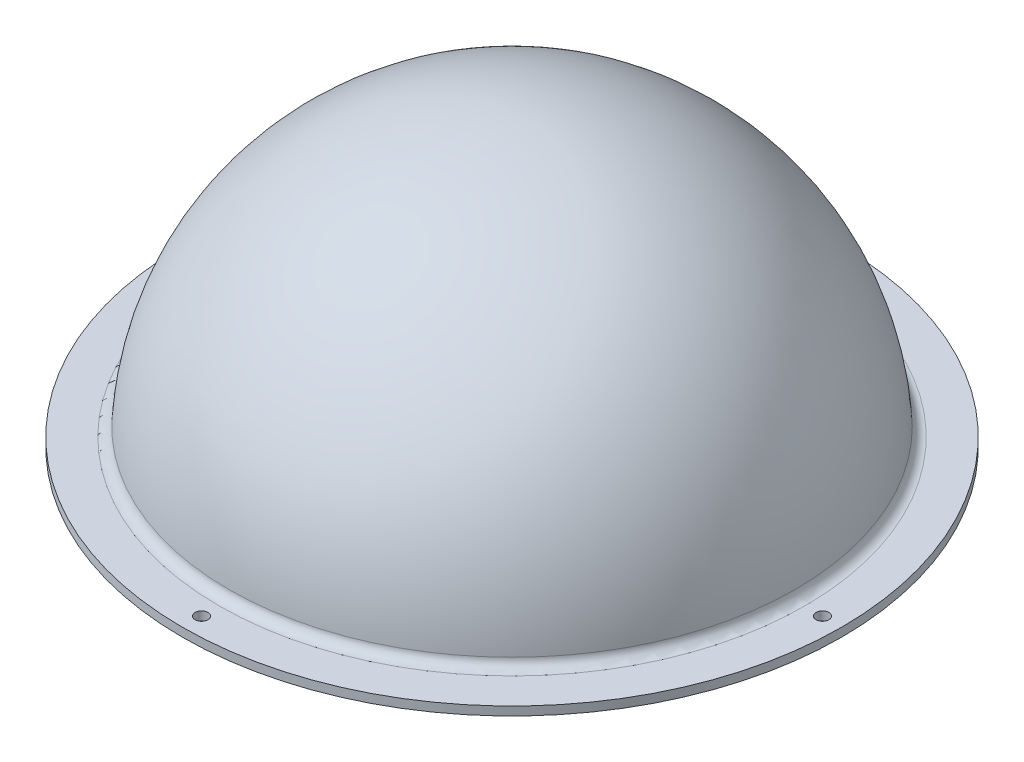
from build123d import *

# Parameters (mm, degrees)
SKETCH2_R        = 1.651
DOME_HOLES_DEPTH = 2.2352
FILLET1_R        = 2.0955
FILLET2_R        = 2.54


# Read off the part's stored shape, not the designer's step: Shell1
with BuildPart() as part:
    # Sketch1 → Revolve1 (revolve)
    with BuildSketch(Plane.XY):
        with BuildLine():
            Line((0, 0), (0, 73.025))
            ThreePointArc((0, 73.025), (50.852351, 52.42273424), (73.025, 2.2352))
            Line((73.025, 2.2352), (84.93125, 2.2352))
            Line((84.93125, 2.2352), (84.93125, 0))
            Line((84.93125, 0), (0, 0))
        make_face()
    revolve(axis=Axis((0, 0, 0), (0, 1, 0)))

    # Shell1 outline → Shell1 (revolve, cut)
    with BuildSketch(Plane.XY):
        with BuildLine():
            Line((0, -7.1e-08), (70.825079619, -7.1e-08))
            ThreePointArc((70.825079619, -7.1e-08), (50.068422427, 50.058086641), (0, 70.7898))
            Line((0, 70.7898), (0, -7.1e-08))
        make_face()
    revolve(axis=Axis((0, 0, 0), (0, 1, 0)), mode=Mode.SUBTRACT)

    # Sketch2 → Dome Holes (cut)
    with BuildSketch(Plane(origin=(0, 2.2352, 0), x_dir=(1, 0, 0), z_dir=(0, 1, 0))):
        with Locations(Location((0, 79.97825, 0), (0, 0, 270))):
            Circle(SKETCH2_R)
        with Locations(Location((79.97825, 0, 0), (0, 0, 270))):
            Circle(SKETCH2_R)
        with Locations(Location((0, -79.97825, 0), (0, 0, 270))):
            Circle(SKETCH2_R)
        with Locations(Location((-79.97825, 0, 0), (0, 0, 270))):
            Circle(SKETCH2_R)
    extrude(amount=-DOME_HOLES_DEPTH, mode=Mode.SUBTRACT)

    # Fillet1
    fillet1_edges = [part.edges().sort_by_distance(p)[0] for p in [
        (-70.825079619, -7.1e-08, 0),
    ]]
    fillet(fillet1_edges, radius=FILLET1_R)

    # Fillet2
    fillet2_edges = [part.edges().sort_by_distance(p)[0] for p in [
        (-73.025, 2.2352, 0),
    ]]
    fillet(fillet2_edges, radius=FILLET2_R)


solid = part.part
